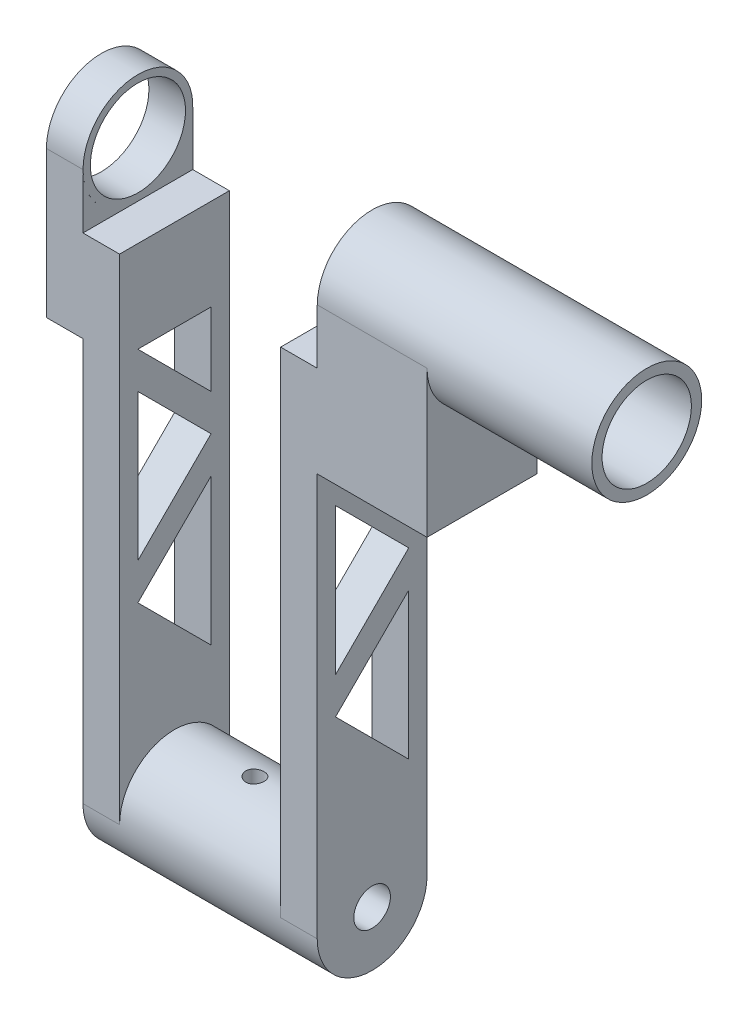
from build123d import *
from build123d.topology import SkipClean

# Parameters (mm, degrees)
CROQUIS2_R                 = 5
SALIENTE_EXTRUIR2_DEPTH    = 64
VACIADO1_START             = 10
VACIADO1_DEPTH             = 44
CORTAR_EXTRUIR1_DEPTH      = 195
CORTAR_EXTRUIR1_DEPTH_BACK = 36
CROQUIS3_R                 = 2.5
CORTAR_EXTRUIR2_DEPTH      = 90
CORTAR_EXTRUIR3_DEPTH      = 90
MATRIZL1_COUNT             = 2
MATRIZL1_PITCH             = 60
CROQUIS7_R                 = 15
CROQUIS7_R_2               = 13
SALIENTE_EXTRUIR3_DEPTH    = 10
SALIENTE_EXTRUIR4_START    = 10
CROQUIS8_R                 = 15
CROQUIS8_R_2               = 13
SALIENTE_EXTRUIR4_DEPTH    = 10
SALIENTE_EXTRUIR5_START    = 65
CROQUIS9_R                 = 15
CROQUIS9_R_2               = 12.2
SALIENTE_EXTRUIR5_DEPTH    = 65
CORTAR_EXTRUIR4_DEPTH      = 65
CORTAR_EXTRUIR4_DEPTH_BACK = 65
CROQUIS11_W                = 64
CROQUIS11_H                = 30
SALIENTE_EXTRUIR6_DEPTH    = 30
SALIENTE_EXTRUIR7_START    = 10
SALIENTE_EXTRUIR7_DEPTH    = 10
SALIENTE_EXTRUIR8_DEPTH    = 10
SALIENTE_EXTRUIR9_DEPTH    = 10


# Read off the part's stored shape, not the designer's step: Vaciado1
with BuildPart() as part:
    # Croquis2 → Saliente-Extruir2 (new body)
    with BuildSketch(Plane(origin=(0, 0, 0), x_dir=(0, 0, -1), z_dir=(1, 0, 0))):
        with BuildLine():
            Line((15, 0), (15, 150))
            ThreePointArc((15, 150), (0, 165), (-15, 150))
            Line((-15, 150), (-15, 0))
            ThreePointArc((-15, 0), (0, -15), (15, 0))
        make_face()
        Circle(CROQUIS2_R, mode=Mode.SUBTRACT)
        with Locations((0, 150)):
            Circle(CROQUIS2_R, mode=Mode.SUBTRACT)
    extrude(amount=SALIENTE_EXTRUIR2_DEPTH)

    # Vaciado1 outline → Vaciado1 (cut)
    with SkipClean():  # the faces are left unmerged after this step: merging them gives an invalid solid
        with BuildSketch(Plane.YZ.offset(VACIADO1_START)):
            with BuildLine():
                ThreePointArc((0, 15), (15, 0), (0, -15))
                Line((0, -15), (150, -15))
                ThreePointArc((150, -15), (135, 0), (150, 15))
                Line((150, 15), (0, 15))
            make_face()
        extrude(amount=VACIADO1_DEPTH, mode=Mode.SUBTRACT)

    # Croquis3 → Cortar-Extruir1 (cut, two sides: drawn at the far end of the back side and taken through both)
    with SkipClean():  # the faces are left unmerged after this step: merging them gives an invalid solid
        with BuildSketch(Plane(origin=(0, 0, 0), x_dir=(1, 0, 0), z_dir=(0, 1, 0)).offset(-CORTAR_EXTRUIR1_DEPTH_BACK)):
            with Locations(Location((32, 0, 0), (0, 0, 90))):
                Circle(CROQUIS3_R)
        extrude(amount=CORTAR_EXTRUIR1_DEPTH + CORTAR_EXTRUIR1_DEPTH_BACK, mode=Mode.SUBTRACT)

    # Croquis4 → Cortar-Extruir2 (cut)
    with SkipClean():  # the faces are left unmerged after this step: merging them gives an invalid solid
        with BuildSketch(Plane(origin=(64, 0, 0), x_dir=(0, 0, -1), z_dir=(1, 0, 0))):
            Polygon((10, 90), (10, 130), (-10, 110), align=None)
        cortar_extruir2 = extrude(amount=-CORTAR_EXTRUIR2_DEPTH, mode=Mode.SUBTRACT)

    # Croquis5 → Cortar-Extruir3 (cut)
    with SkipClean():  # the faces are left unmerged after this step: merging them gives an invalid solid
        with BuildSketch(Plane.ZY):
            Polygon((10, 60), (-10, 80), (10, 100), align=None)
        extrude(amount=-CORTAR_EXTRUIR3_DEPTH, mode=Mode.SUBTRACT)

    # MatrizL1: Cortar-Extruir2 ×2
    with SkipClean():  # the faces are left unmerged after this step: merging them gives an invalid solid
        with Locations(*[(0, -i * MATRIZL1_PITCH, 0) for i in range(1, MATRIZL1_COUNT)]):
            add(cortar_extruir2, mode=Mode.SUBTRACT)

    # Croquis7 → Saliente-Extruir3 (add)
    with SkipClean():  # the faces are left unmerged after this step: merging them gives an invalid solid
        with BuildSketch(Plane.ZY):
            with Locations(Location((-0.021695503, 149.976346025, 0), (0, 0, 183.081975769))):
                Circle(CROQUIS7_R)
            with Locations((-0.021695503, 149.976346025)):
                Circle(CROQUIS7_R_2, mode=Mode.SUBTRACT)
        extrude(amount=SALIENTE_EXTRUIR3_DEPTH)

    # Croquis8 → Saliente-Extruir4 (add)
    with SkipClean():  # the faces are left unmerged after this step: merging them gives an invalid solid
        with BuildSketch(Plane(origin=(64, 0, 0), x_dir=(0, 0, -1), z_dir=(1, 0, 0)).offset(SALIENTE_EXTRUIR4_START)):
            with Locations(Location((0.021695503, 149.976346025, 0), (0, 0, 356.918024231))):
                Circle(CROQUIS8_R)
            with Locations(Location((0.021695503, 149.976346025, 0), (0, 0, 180))):
                Circle(CROQUIS8_R_2, mode=Mode.SUBTRACT)
        extrude(amount=-SALIENTE_EXTRUIR4_DEPTH)

    # Croquis9 → Saliente-Extruir5 (add)
    with SkipClean():  # the faces are left unmerged after this step: merging them gives an invalid solid
        with BuildSketch(Plane(origin=(74, 0, 0), x_dir=(0, 0, -1), z_dir=(1, 0, 0)).offset(SALIENTE_EXTRUIR5_START)):
            with Locations(Location((0.021695503, 149.976346025, 0), (0, 0, 356.918024231))):
                Circle(CROQUIS9_R)
            with Locations((0.021695503, 149.976346025)):
                Circle(CROQUIS9_R_2, mode=Mode.SUBTRACT)
        extrude(amount=-SALIENTE_EXTRUIR5_DEPTH)

    # Croquis11 → Cortar-Extruir4 (cut, two sides: drawn at the far end of the back side and taken through both)
    with SkipClean():  # the faces are left unmerged after this step: merging them gives an invalid solid
        with BuildSketch(Plane.XY.offset(-CORTAR_EXTRUIR4_DEPTH_BACK)):
            with Locations((32, 150)):
                Rectangle(CROQUIS11_W, CROQUIS11_H)
        extrude(amount=CORTAR_EXTRUIR4_DEPTH + CORTAR_EXTRUIR4_DEPTH_BACK, mode=Mode.SUBTRACT)

    # Croquis12 → Saliente-Extruir6 (add)
    with SkipClean():  # the faces are left unmerged after this step: merging them gives an invalid solid
        with BuildSketch(Plane(origin=(64, 0, 0), x_dir=(0, 0, -1), z_dir=(1, 0, 0))):
            with BuildLine():
                Line((-15, 135), (-15, 110))
                Line((-15, 110), (15, 110))
                Line((15, 110), (15, 135))
                Line((15, 135), (15, 150))
                ThreePointArc((15, 150), (0, 135), (-15, 150))
                Line((-15, 150), (-15, 135))
            make_face()
        extrude(amount=SALIENTE_EXTRUIR6_DEPTH)

    # Croquis13 → Saliente-Extruir7 (add)
    with SkipClean():  # the faces are left unmerged after this step: merging them gives an invalid solid
        with BuildSketch(Plane.ZY.offset(SALIENTE_EXTRUIR7_START)):
            with BuildLine():
                Line((-15, 135), (-15, 150))
                ThreePointArc((-15, 150), (0, 135), (15, 150))
                Line((15, 150), (15, 135))
                Line((15, 135), (15, 110))
                Line((15, 110), (-15, 110))
                Line((-15, 110), (-15, 135))
            make_face()
        extrude(amount=-SALIENTE_EXTRUIR7_DEPTH)

    # Croquis14 → Saliente-Extruir8 (add)
    with SkipClean():  # the faces are left unmerged after this step: merging them gives an invalid solid
        with BuildSketch(Plane(origin=(10, 0, 0), x_dir=(0, 0, -1), z_dir=(1, 0, 0))):
            Polygon((-10, 110), (10, 130), (10, 110), align=None)
        extrude(amount=-SALIENTE_EXTRUIR8_DEPTH)

    # Croquis15 → Saliente-Extruir9 (add)
    with SkipClean():  # the faces are left unmerged after this step: merging them gives an invalid solid
        with BuildSketch(Plane.ZY.offset(-54)):
            Polygon((-10, 130), (10, 110), (-10, 110), align=None)
        extrude(amount=-SALIENTE_EXTRUIR9_DEPTH)


solid = part.part
